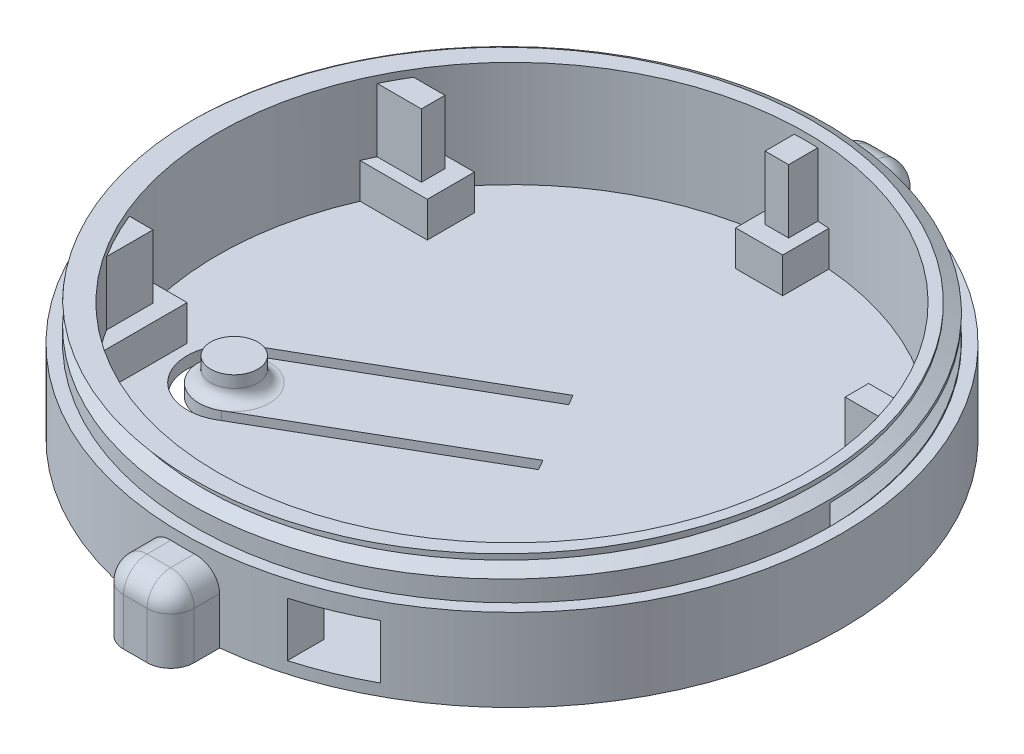
from build123d import *
from build123d.topology import SkipClean

# Parameters (mm, degrees)
SKETCH1_R              = 13.5
SKETCH1_R_2            = 12.5
BOSS_EXTRUDE1_DEPTH    = 5
SKETCH1_2_R            = 12.5
BOSS_EXTRUDE3_DEPTH    = 0.5
SKETCH1_3_R            = 14
SKETCH1_3_R_2          = 13.5
SKETCH1_3_R_3          = 13
SKETCH1_3_R_4          = 12.5
EXTRUDE_THIN1_DEPTH    = 3.5
SKETCH12_W             = 2.5
SKETCH12_H             = 2.5
SKETCH12_R             = 0.5
BOSS_EXTRUDE10_DEPTH   = 1.5
BOSS_EXTRUDE12_DEPTH   = 2.7
CUT_EXTRUDE1_DEPTH     = 10
SKETCH14_R             = 1
BOSS_EXTRUDE11_DEPTH   = 1
FILLET7_R              = 0.5
CUT_EXTRUDE2_DEPTH     = 2.3
BOSS_EXTRUDE13_DEPTH   = 3
BOSS_EXTRUDE13_2_DEPTH = 3
FILLET8_R              = 1
FILLET9_R              = 1
THREAD1_PITCH          = 1


with BuildPart() as part:
    # Sketch1 → Boss-Extrude1 (new body)
    with BuildSketch(Plane(origin=(0, 0, 0), x_dir=(1, 0, 0), z_dir=(0, 1, 0))):
        with Locations(Location((0, 0, 0), (0, 0, 270))):
            Circle(SKETCH1_R)
        with Locations(Location((0, 0, 0), (0, 0, 270))):
            Circle(SKETCH1_R_2, mode=Mode.SUBTRACT)
    extrude(amount=BOSS_EXTRUDE1_DEPTH)

    # Sketch1<2> → Boss-Extrude3 (add)
    with BuildSketch(Plane(origin=(0, 0, 0), x_dir=(1, 0, 0), z_dir=(0, 1, 0))):
        with Locations(Location((0, 0, 0), (0, 0, 270))):
            Circle(SKETCH1_2_R)
    extrude(amount=BOSS_EXTRUDE3_DEPTH)

    # Sketch1<3> → Extrude-Thin1 (add)
    # profile 1 of 2: a face of its own
    with BuildSketch(Plane(origin=(0, 0, 0), x_dir=(1, 0, 0), z_dir=(0, 1, 0))):
        Circle(SKETCH1_3_R)
        Circle(SKETCH1_3_R_2, mode=Mode.SUBTRACT)
    # profile 2 of 2: a face of its own
    with BuildSketch(Plane(origin=(0, 0, 0), x_dir=(1, 0, 0), z_dir=(0, 1, 0))):
        Circle(SKETCH1_3_R_3)
        Circle(SKETCH1_3_R_4, mode=Mode.SUBTRACT)
    extrude(amount=EXTRUDE_THIN1_DEPTH)

    # Sketch12 → Boss-Extrude10 (add)
    # profile 1 of 5: a face of its own
    with BuildSketch(Plane(origin=(0, 0.5, 0), x_dir=(1, 0, 0), z_dir=(0, 1, 0))):
        with BuildLine():
            Line((-8.6, 5), (-8.6, 7))
            Line((-8.6, 7), (-10.356157589, 7))
            ThreePointArc((-10.356157589, 7), (-10.952047529, 6.025168456), (-11.456439237, 5))
            Line((-11.456439237, 5), (-8.6, 5))
        make_face()
    # profile 2 of 5: a face of its own
    with BuildSketch(Plane(origin=(0, 0.5, 0), x_dir=(1, 0, 0), z_dir=(0, 1, 0))):
        with BuildLine():
            Line((-1, 10.5), (1, 10.5))
            Line((1, 10.5), (1, 12.459935794))
            ThreePointArc((1, 12.459935794), (0, 12.5), (-1, 12.459935794))
            Line((-1, 12.459935794), (-1, 10.5))
        make_face()
    # profile 3 of 5: a face of its own
    with BuildSketch(Plane(origin=(0, 0.5, 0), x_dir=(1, 0, 0), z_dir=(0, 1, 0))):
        with BuildLine():
            Line((11.273420067, 5.4), (9.5, 5.4))
            Line((9.5, 5.4), (9.5, 3.4))
            Line((9.5, 3.4), (12.028715642, 3.4))
            ThreePointArc((12.028715642, 3.4), (11.693903632, 4.416176837), (11.273420067, 5.4))
        make_face()
    # profile 4 of 5: a face of its own
    with BuildSketch(Plane(origin=(0, 0.5, 0), x_dir=(1, 0, 0), z_dir=(0, 1, 0))):
        with BuildLine():
            Line((-9.9, -3.9), (-11.876026271, -3.9))
            ThreePointArc((-11.876026271, -3.9), (-11.046713471, -5.849796706), (-9.9, -7.631513611))
            Line((-9.9, -7.631513611), (-9.9, -3.9))
        make_face()
    # profile 5 of 5: a face of its own
    with BuildSketch(Plane(origin=(0, 0.5, 0), x_dir=(1, 0, 0), z_dir=(0, 1, 0))):
        with Locations((9.5, -4.1)):
            Rectangle(SKETCH12_W, SKETCH12_H)
        with Locations(Location((9.5, -4.1, 0), (0, 0, 270))):
            Circle(SKETCH12_R, mode=Mode.SUBTRACT)
    extrude(amount=BOSS_EXTRUDE10_DEPTH)

    # Sketch15 → Boss-Extrude12 (add)
    with BuildSketch(Plane(origin=(0, 2, 0), x_dir=(1, 0, 0), z_dir=(0, 1, 0))):
        with BuildLine():
            Line((0.5, 11.25), (0.5, 12.489995997))
            ThreePointArc((0.5, 12.489995997), (0, 12.5), (-0.5, 12.489995997))
            Line((-0.5, 12.489995997), (-0.5, 11.25))
            Line((-0.5, 11.25), (0.5, 11.25))
        make_face()
        with BuildLine():
            Line((-9.35, 5.5), (-9.35, 6))
            Line((-9.35, 6), (-9.35, 6.5))
            Line((-9.35, 6.5), (-10.677078252, 6.5))
            ThreePointArc((-10.677078252, 6.5), (-10.96243372, 6.006250655), (-11.22497216, 5.5))
            Line((-11.22497216, 5.5), (-9.35, 5.5))
        make_face()
        with BuildLine():
            Line((-11.602909118, -4.65), (-10.602909118, -4.65))
            Line((-10.602909118, -4.65), (-10.602909118, -6.620295933))
            ThreePointArc((-10.602909118, -6.620295933), (-11.146528939, -5.657286682), (-11.602909118, -4.65))
        make_face()
        with BuildLine():
            Line((10.25, 3.9), (11.876026271, 3.9))
            ThreePointArc((11.876026271, 3.9), (11.698485768, 4.404024379), (11.499565209, 4.9))
            Line((11.499565209, 4.9), (10.25, 4.9))
            Line((10.25, 4.9), (10.25, 3.9))
        make_face()
    extrude(amount=BOSS_EXTRUDE12_DEPTH)

    # Sketch13 → Cut-Extrude1 (cut)
    with BuildSketch(Plane(origin=(0, 0.5, 0), x_dir=(1, 0, 0), z_dir=(0, 1, 0))):
        with BuildLine():
            Line((0.209608339, 2.382785463), (-8.450166114, -2.618045109))
            ThreePointArc((-8.450166114, -2.618045109), (-7.773231209, -2.376292426), (-7.054544105, -2.38948613))
            Line((-7.054544105, -2.38948613), (0.459649868, 1.94979674))
            Line((0.459649868, 1.94979674), (0.209608339, 2.382785463))
        make_face()
        with BuildLine():
            ThreePointArc((-7.054544105, -2.38948613), (-7.773231209, -2.376292426), (-8.450166114, -2.618045109))
            Line((-8.450166114, -2.618045109), (-8.200124586, -3.051033832))
            Line((-8.200124586, -3.051033832), (-7.054544105, -2.38948613))
        make_face()
        with BuildLine():
            ThreePointArc((-8.450166114, -2.618045109), (-9.181954891, -5.350166114), (-6.449833886, -6.081954891))
            Line((-6.449833886, -6.081954891), (-6.699875414, -5.648966168))
            ThreePointArc((-6.699875414, -5.648966168), (-8.748966168, -5.100124586), (-8.200124586, -3.051033832))
            Line((-8.200124586, -3.051033832), (-8.450166114, -2.618045109))
        make_face()
        with BuildLine():
            Line((-6.699875414, -5.648966168), (-6.449833886, -6.081954891))
            ThreePointArc((-6.449833886, -6.081954891), (-5.902091744, -5.616483332), (-5.554294933, -4.987418466))
            Line((-5.554294933, -4.987418466), (-6.699875414, -5.648966168))
        make_face()
        with BuildLine():
            ThreePointArc((-5.554294933, -4.987418466), (-5.902091744, -5.616483332), (-6.449833886, -6.081954891))
            Line((-6.449833886, -6.081954891), (2.209940568, -1.081124319))
            Line((2.209940568, -1.081124319), (1.95989904, -0.648135596))
            Line((1.95989904, -0.648135596), (-5.554294933, -4.987418466))
        make_face()
    extrude(amount=-CUT_EXTRUDE1_DEPTH, mode=Mode.SUBTRACT)

    # Sketch14 → Boss-Extrude11 (add)
    with BuildSketch(Plane(origin=(0, 0.5, 0), x_dir=(1, 0, 0), z_dir=(0, 1, 0))):
        with Locations(Location((-7.45, -4.35, 0), (0, 0, 270))):
            Circle(SKETCH14_R)
    extrude(amount=BOSS_EXTRUDE11_DEPTH)

    # Fillet7
    fillet7_edges = [part.edges().sort_by_distance(p)[0] for p in [
        (-7.45, 0.5, 3.35),
    ]]
    fillet(fillet7_edges, radius=FILLET7_R - 0.0001)  # a hair under: the kernel refuses the full size

    # Sketch16 → Cut-Extrude2 (cut)
    with BuildSketch(Plane(origin=(0, 0.5, 0), x_dir=(1, 0, 0), z_dir=(0, 1, 0))):
        with BuildLine():
            Line((3.9, -10.1), (3.9, -13.445817193))
            ThreePointArc((3.9, -13.445817193), (5.331269165, -12.945175514), (6.7, -12.292680749))
            Line((6.7, -12.292680749), (6.7, -9.45))
            Line((6.7, -9.45), (3.9, -10.1))
        make_face()
    extrude(amount=CUT_EXTRUDE2_DEPTH, mode=Mode.SUBTRACT)

    # Thread1: the profile of Thread Profile1 profile screwed along a right-hand helix of 4 turns, 8 arcs to a turn; built about Z, then put on its axis
    with SkipClean():  # the faces are left unmerged after this step: merging them gives an invalid solid
        thread1_z = Axis((0, 0, 0), (0, 0, 1))
        thread1_corners = [(13.5003, 0, -0.000173205), (13.5003, 0, 0.875173202), (12.958734125, 0, 0.562499999), (12.958734125, 0, 0.312499999)]
        with BuildLine(mode=Mode.PRIVATE) as thread1_profile:
            Line(thread1_corners[0], thread1_corners[1])
            Line(thread1_corners[1], thread1_corners[2])
            Line(thread1_corners[2], thread1_corners[3])
            Line(thread1_corners[3], thread1_corners[0])
        thread1_cap = Face(thread1_profile.wire())
        thread1_turn_angles = [0, 22.5, 45, 67.5, 90, 112.5, 135, 157.5, 180, 202.5, 225, 247.5, 270, 292.5, 315, 337.5, 360]
        thread1_turn_weights = [1, 0.9238795325112867, 1, 0.9238795325112867, 1, 0.9238795325112867, 1, 0.9238795325112867, 1, 0.9238795325112867, 1, 0.9238795325112867, 1, 0.9238795325112867, 1, 0.9238795325112867, 1]
        thread1_turn_rails = [Edge.make_bspline([Vector(p[0], p[1], 0).rotate(thread1_z, thread1_turn_angles[k]) / thread1_turn_weights[k] + Vector(0, 0, p[2] + THREAD1_PITCH * thread1_turn_angles[k] / 360) for k in range(17)], [0, 0, 0, 1, 1, 2, 2, 3, 3, 4, 4, 5, 5, 6, 6, 7, 7, 8, 8, 8], 2, thread1_turn_weights) for p in thread1_corners]
        thread1_turn_sides = [Face.make_surface_from_curves(thread1_turn_rails[p[0]], thread1_turn_rails[p[1]]) for p in [(0, 1), (1, 2), (2, 3), (3, 0)]]
        thread1 = Plane(origin=(0, 3.5, 0), x_dir=(1, 0, 0), z_dir=(0, 1, 0)) * Solid(Shell([*[p.moved(Location((0, 0, THREAD1_PITCH * i))) for i in range(4) for p in thread1_turn_sides], thread1_cap, thread1_cap.rotate(thread1_z, 1440).moved(Location((0, 0, THREAD1_PITCH * 1440 / 360)))]))
        add(thread1, mode=Mode.SUBTRACT)


with BuildPart() as body_2:
    # Sketch17 → Boss-Extrude13 (new body)
    with BuildSketch(Plane(origin=(0, 0, 0), x_dir=(-1, 0, 0), z_dir=(0, -1, 0))):
        with BuildLine():
            Line((1.5, -15), (1.5, -13.919410907))
            ThreePointArc((1.5, -13.919410907), (0, -14), (-1.5, -13.919410907))
            Line((-1.5, -13.919410907), (-1.5, -15))
            ThreePointArc((-1.5, -15), (-1.207106781, -15.707106781), (-0.5, -16))
            Line((-0.5, -16), (0.5, -16))
            ThreePointArc((0.5, -16), (1.207106781, -15.707106781), (1.5, -15))
        make_face()
    extrude(amount=-BOSS_EXTRUDE13_DEPTH)

    # Fillet9
    fillet9_edges = [body_2.edges().sort_by_distance(p)[0] for p in [
        (1.5, 3, 14.459705454),
        (1.207106781, 3, 15.707106781),
        (0, 3, 16),
        (-1.207106781, 3, 15.707106781),
        (-1.5, 3, 14.459705454),
    ]]
    fillet(fillet9_edges, radius=FILLET9_R)


with BuildPart() as body_3:
    # Sketch17 → Boss-Extrude13 2 (new body)
    with BuildSketch(Plane(origin=(0, 0, 0), x_dir=(-1, 0, 0), z_dir=(0, -1, 0))):
        with BuildLine():
            ThreePointArc((1.5, 15), (1.207106781, 15.707106781), (0.5, 16))
            Line((0.5, 16), (-0.5, 16))
            ThreePointArc((-0.5, 16), (-1.207106781, 15.707106781), (-1.5, 15))
            Line((-1.5, 15), (-1.5, 13.919410907))
            ThreePointArc((-1.5, 13.919410907), (0, 14), (1.5, 13.919410907))
            Line((1.5, 13.919410907), (1.5, 15))
        make_face()
    extrude(amount=-BOSS_EXTRUDE13_2_DEPTH)

    # Fillet8
    fillet8_edges = [body_3.edges().sort_by_distance(p)[0] for p in [
        (1.207106781, 3, -15.707106781),
        (1.5, 3, -14.459705454),
        (-1.5, 3, -14.459705454),
        (-1.207106781, 3, -15.707106781),
        (0, 3, -16),
    ]]
    fillet(fillet8_edges, radius=FILLET8_R)


solid = Compound([part.part, body_2.part, body_3.part])
